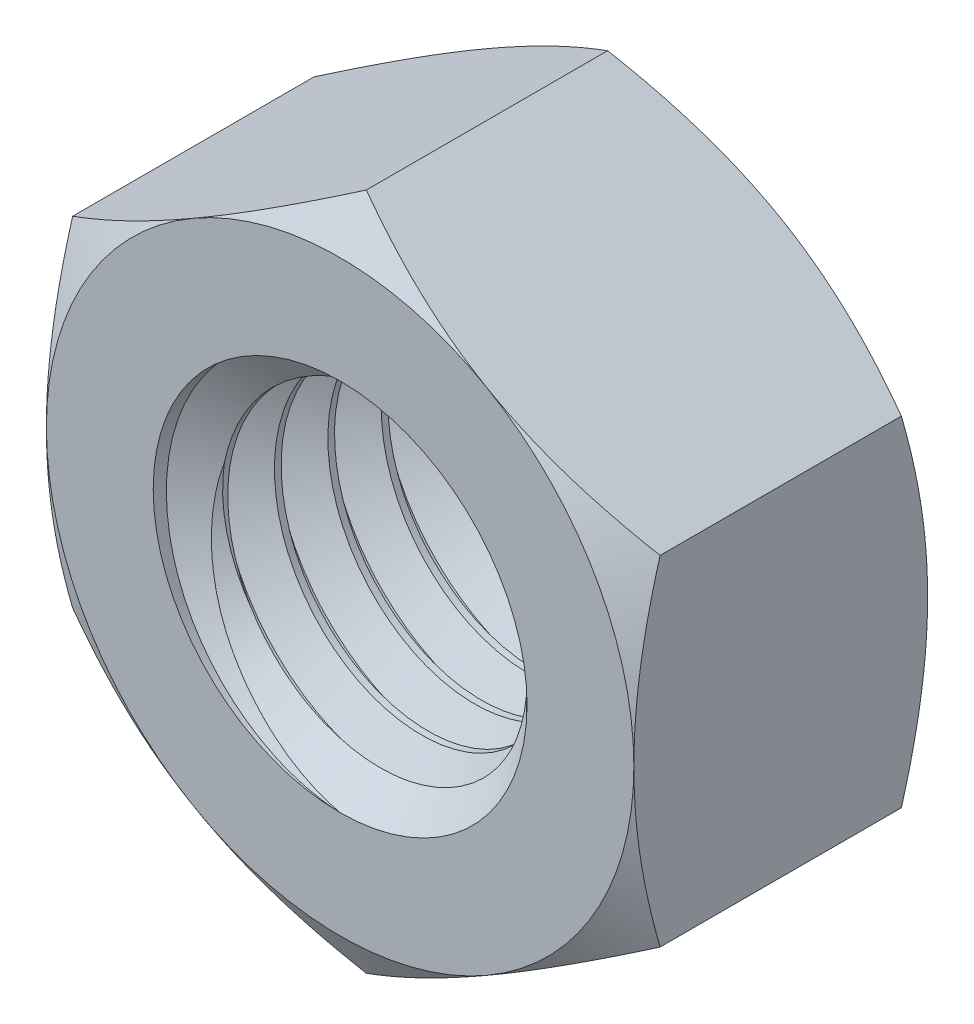
from build123d import *

# Parameters (mm, degrees)
EXTRUDE1_DEPTH          = 2.75
SKETCH13_R              = 3.5
BOSS_EXTRUDE1_DEPTH     = 5.5
CUT_SWEEP1_PITCH        = 1
SKETCH7_OUTSIDE_W       = 104.524
SKETCH7_OUTSIDE_H       = 106.226
SKETCH7_OUTSIDE_R       = 5.5
EXTRUDE2_DEPTH          = 25.4
EXTRUDE2_DRAFT          = -60
MIRROR2_COPY_1_SKETCH_W = 104.524
MIRROR2_COPY_1_SKETCH_H = 106.226
MIRROR2_COPY_1_SKETCH_R = 5.5
MIRROR2_COPY_1_DEPTH    = 25.4
MIRROR2_COPY_1_DRAFT    = -60


with BuildPart() as part:
    # Sketch1 → Extrude1 (new, symmetric)
    with BuildSketch(Plane.XY):
        Polygon((-5.5, 3.175426481), (-5.5, -3.175426481), (0, -6.350852961), (5.5, -3.175426481), (5.5, 3.175426481), (0, 6.350852961), align=None)
    extrude(amount=EXTRUDE1_DEPTH, both=True)

    # Cut-Extrude2 cone 1 section (through the dimple's axis) → Cut-Extrude2 (revolve, cut)
    with BuildSketch(Plane(origin=(0, 0, 2.75), x_dir=(0, -1, 0), z_dir=(1, 0, 0))):
        Polygon((0, 0), (3.5, 0), (0, 3.5), align=None)
    revolve(axis=Axis((0, 0, 2.75), (0, 0, -1)), mode=Mode.SUBTRACT)

    # Cut-Extrude3 cone 1 section (through the dimple's axis) → Cut-Extrude3 (revolve, cut)
    with BuildSketch(Plane(origin=(0, 0, -2.75), x_dir=(0, 1, 0), z_dir=(1, 0, 0))):
        Polygon((0, 0), (3.5, 0), (0, 3.5), align=None)
    revolve(axis=Axis((0, 0, -2.75), (0, 0, 1)), mode=Mode.SUBTRACT)


with BuildPart() as body_2:
    # Sketch13 → Boss-Extrude1 (new body)
    with BuildSketch(Plane(origin=(0, 0, -2.75), x_dir=(-1, 0, 0), z_dir=(0, 0, -1))):
        Circle(SKETCH13_R)
    extrude(amount=-BOSS_EXTRUDE1_DEPTH)

    # Cut-Sweep1: arcs per turn and ends read off the stored shape
    # Cut-Sweep1: the profile of Sketch12 profile screwed along a right-hand helix through 7 turns, 8 arcs to a turn; built about Z, then put on its axis
    cut_sweep1_z = Axis((0, 0, 0), (0, 0, 1))
    cut_sweep1_corners = [(3.5003, 0, -1.875173205), (3.5003, 0, -0.999826795), (2.850480947, 0, -1.375), (2.850480947, 0, -1.5)]
    with BuildLine(mode=Mode.PRIVATE) as cut_sweep1_profile:
        Line(cut_sweep1_corners[0], cut_sweep1_corners[1])
        Line(cut_sweep1_corners[1], cut_sweep1_corners[2])
        Line(cut_sweep1_corners[2], cut_sweep1_corners[3])
        Line(cut_sweep1_corners[3], cut_sweep1_corners[0])
    cut_sweep1_cap = Face(cut_sweep1_profile.wire())
    cut_sweep1_turn_angles = [0, 22.5, 45, 67.5, 90, 112.5, 135, 157.5, 180, 202.5, 225, 247.5, 270, 292.5, 315, 337.5, 360]
    cut_sweep1_turn_weights = [1, 0.9238795325112867, 1, 0.9238795325112867, 1, 0.9238795325112867, 1, 0.9238795325112867, 1, 0.9238795325112867, 1, 0.9238795325112867, 1, 0.9238795325112867, 1, 0.9238795325112867, 1]
    cut_sweep1_turn_rails = [Edge.make_bspline([Vector(p[0], p[1], 0).rotate(cut_sweep1_z, cut_sweep1_turn_angles[k]) / cut_sweep1_turn_weights[k] + Vector(0, 0, p[2] + CUT_SWEEP1_PITCH * cut_sweep1_turn_angles[k] / 360) for k in range(17)], [0, 0, 0, 1, 1, 2, 2, 3, 3, 4, 4, 5, 5, 6, 6, 7, 7, 8, 8, 8], 2, cut_sweep1_turn_weights) for p in cut_sweep1_corners]
    cut_sweep1_turn_sides = [Face.make_surface_from_curves(cut_sweep1_turn_rails[p[0]], cut_sweep1_turn_rails[p[1]]) for p in [(0, 1), (1, 2), (2, 3), (3, 0)]]
    cut_sweep1 = Plane(origin=(0, 0, -2.75), x_dir=(0, 1, 0), z_dir=(0, 0, 1)) * Solid(Shell([*[p.moved(Location((0, 0, CUT_SWEEP1_PITCH * i))) for i in range(7) for p in cut_sweep1_turn_sides], cut_sweep1_cap, cut_sweep1_cap.rotate(cut_sweep1_z, 2520).moved(Location((0, 0, CUT_SWEEP1_PITCH * 2520 / 360)))]))
    add(cut_sweep1, mode=Mode.SUBTRACT)


with BuildPart() as part_1:
    add(part.part)

    # Combine1: cut body 2
    add(body_2.part, mode=Mode.SUBTRACT)


with BuildPart() as extrude2_tool:
    # Sketch7 outside → Extrude2 (with draft: the straight prism first)
    with BuildSketch(Plane.XY.offset(2.75)):
        Rectangle(SKETCH7_OUTSIDE_W, SKETCH7_OUTSIDE_H)
        Circle(SKETCH7_OUTSIDE_R, mode=Mode.SUBTRACT)
    extrude(amount=-EXTRUDE2_DEPTH)
    # Extrude2: the draft: its side faces are tilted about the plane it starts from
    extrude2_sides = [extrude2_tool.faces().sort_by_distance(p)[0] for p in [
        (0, -53.113, -9.95),
        (52.262, 0, -9.95),
        (0, 53.113, -9.95),
        (-52.262, 0, -9.95),
        (-5.5, 0, -9.95),
    ]]
    draft(extrude2_sides, Plane.XY.offset(2.75), EXTRUDE2_DRAFT)


with BuildPart() as part_2:
    add(part_1.part)

    # Extrude2: cut by extrude2_tool
    add(extrude2_tool.part, mode=Mode.SUBTRACT)


with BuildPart() as mirror2_copy_1_tool:
    # Mirror2 copy 1 sketch → Mirror2 copy 1 (with draft: the straight prism first)
    with BuildSketch(Plane(origin=(0, 0, -2.75), x_dir=(1, 0, 0), z_dir=(0, 0, -1))):
        Rectangle(MIRROR2_COPY_1_SKETCH_W, MIRROR2_COPY_1_SKETCH_H)
        Circle(MIRROR2_COPY_1_SKETCH_R, mode=Mode.SUBTRACT)
    extrude(amount=-MIRROR2_COPY_1_DEPTH)
    # Mirror2 copy 1: the draft: its side faces are tilted about the plane it starts from
    mirror2_copy_1_sides = [mirror2_copy_1_tool.faces().sort_by_distance(p)[0] for p in [
        (0, -53.113, 9.95),
        (52.262, 0, 9.95),
        (0, 53.113, 9.95),
        (-52.262, 0, 9.95),
        (-5.5, 0, 9.95),
    ]]
    draft(mirror2_copy_1_sides, Plane(origin=(0, 0, -2.75), x_dir=(1, 0, 0), z_dir=(0, 0, -1)), MIRROR2_COPY_1_DRAFT)


with BuildPart() as part_3:
    add(part_2.part)

    # Mirror2 copy 1: cut by mirror2_copy_1_tool
    add(mirror2_copy_1_tool.part, mode=Mode.SUBTRACT)


solid = part_3.part
